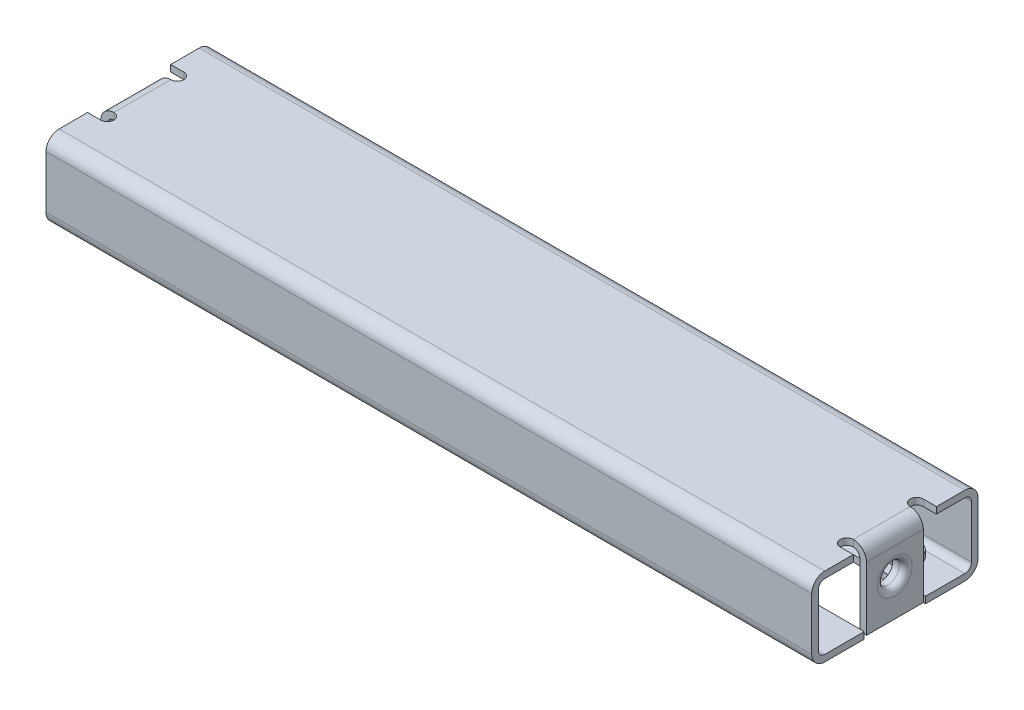
from build123d import *

# Parameters (mm, degrees)
BOSS_EXTRUDE1_DEPTH = 87.5
CUT_EXTRUDE1_REACH  = 93.33
BOSS_EXTRUDE2_DEPTH = 6.5
SKETCH4_W           = 3
SKETCH4_H           = 3.55
SKETCH5_W           = 175
SKETCH5_H           = 2.4585
FILLET1_R           = 1.5
SKETCH8_R           = 3.15
BOSS_EXTRUDE4_DEPTH = 1.5
SKETCH9_R           = 2.067
CUT_EXTRUDE3_DEPTH  = 91.786838253
FILLET3_R           = 1.5
FILLET4_R           = 3
FILLET5_R           = 1.5


with BuildPart() as part:
    # Sketch1 → Boss-Extrude1 (new, symmetric)
    with BuildSketch(Plane(origin=(0, 0, 0), x_dir=(0, 0, -1), z_dir=(1, 0, 0))):
        Polygon((-19, -9), (-7, -9), (-7, -7.5), (-17.5, -7.5), (-17.5, 7.5), (17.5, 7.5), (17.5, -7.5), (7, -7.5), (7, -9), (19, -9), (19, 9), (-19, 9), align=None)
    extrude(amount=BOSS_EXTRUDE1_DEPTH, both=True)

    # Sketch2 → Cut-Extrude1 (cut, up to next)
    with BuildSketch(Plane(origin=(0, 9, 0), x_dir=(1, 0, 0), z_dir=(0, 1, 0)), mode=Mode.PRIVATE) as cut_extrude1_sk1:
        with BuildLine():
            Line((84.5, 9.5), (87.5, 9.5))
            Line((87.5, 9.5), (87.5, -9.5))
            Line((87.5, -9.5), (84.5, -9.5))
            ThreePointArc((84.5, -9.5), (83, -8), (84.5, -6.5))
            Line((84.5, -6.5), (84.5, 6.5))
            ThreePointArc((84.5, 6.5), (83, 8), (84.5, 9.5))
        make_face()
    cut_extrude1_tool1 = extrude(cut_extrude1_sk1.sketch, amount=-CUT_EXTRUDE1_REACH, mode=Mode.PRIVATE) & part.part
    # Sketch2 → Cut-Extrude1 (cut, up to next)
    with BuildSketch(Plane(origin=(0, 9, 0), x_dir=(1, 0, 0), z_dir=(0, 1, 0)), mode=Mode.PRIVATE) as cut_extrude1_sk2:
        with BuildLine():
            Line((-84.5, 9.5), (-87.5, 9.5))
            Line((-87.5, 9.5), (-87.5, -9.5))
            Line((-87.5, -9.5), (-84.5, -9.5))
            ThreePointArc((-84.5, -9.5), (-83, -8), (-84.5, -6.5))
            Line((-84.5, -6.5), (-84.5, 6.5))
            ThreePointArc((-84.5, 6.5), (-83, 8), (-84.5, 9.5))
        make_face()
    cut_extrude1_tool2 = extrude(cut_extrude1_sk2.sketch, amount=-CUT_EXTRUDE1_REACH, mode=Mode.PRIVATE) & part.part
    add(cut_extrude1_tool1.solids().sort_by_distance((85.76427, 9, 0))[0], mode=Mode.SUBTRACT)
    add(cut_extrude1_tool2.solids().sort_by_distance((-85.76427, 9, 0))[0], mode=Mode.SUBTRACT)

    # Sketch3 → Boss-Extrude2 (add, symmetric)
    with BuildSketch(Plane.XY):
        with BuildLine():
            Line((87.5, -8.5), (87.5, 6))
            ThreePointArc((87.5, 6), (86.621320344, 8.121320344), (84.5, 9))
            Line((84.5, 9), (84.5, 7.5))
            ThreePointArc((84.5, 7.5), (85.560660172, 7.060660172), (86, 6))
            Line((86, 6), (86, -8.5))
            Line((86, -8.5), (87.5, -8.5))
        make_face()
        with BuildLine():
            Line((-87.5, -8.5), (-87.5, 6))
            ThreePointArc((-87.5, 6), (-86.621320344, 8.121320344), (-84.5, 9))
            Line((-84.5, 9), (-84.5, 7.5))
            ThreePointArc((-84.5, 7.5), (-85.560660172, 7.060660172), (-86, 6))
            Line((-86, 6), (-86, -8.5))
            Line((-86, -8.5), (-87.5, -8.5))
        make_face()
    extrude(amount=BOSS_EXTRUDE2_DEPTH, both=True)

    # Sketch4 → Revolve1 (revolve)
    with BuildSketch(Plane.XY, mode=Mode.PRIVATE) as revolve1_sk:
        with Locations((-86, 1.775)):
            Rectangle(SKETCH4_W, SKETCH4_H)
        with Locations((86, 1.775)):
            Rectangle(SKETCH4_W, SKETCH4_H)
    revolve(revolve1_sk.sketch.rotate(Axis((-87.5, 0, 0), (1, 0, 0)), 90), axis=Axis((-87.5, 0, 0), (1, 0, 0)))

    # Sketch5 → Cut-Revolve1 (revolve, cut)
    with BuildSketch(Plane.XY, mode=Mode.PRIVATE) as cut_revolve1_sk:
        with Locations((0, 1.22925)):
            Rectangle(SKETCH5_W, SKETCH5_H)
    revolve(cut_revolve1_sk.sketch.rotate(Axis((-87.5, 0, 0), (1, 0, 0)), 90), axis=Axis((-87.5, 0, 0), (1, 0, 0)), mode=Mode.SUBTRACT)

    # Fillet1
    fillet1_edges = [part.edges().sort_by_distance(p)[0] for p in [
        (87.5, 0, -2.4585),
        (-87.5, 0, -2.4585),
    ]]
    fillet(fillet1_edges, radius=FILLET1_R)

    # Sketch8 → Boss-Extrude4 (add)
    with BuildSketch(Plane(origin=(0, -7.5, 0), x_dir=(1, 0, 0), z_dir=(0, 1, 0))):
        with Locations(Location((-77.5, 12.5, 0), (0, 0, 90))):
            Circle(SKETCH8_R)
        with Locations(Location((-37.5, 12.5, 0), (0, 0, 90))):
            Circle(SKETCH8_R)
        with Locations(Location((-77.5, -12.5, 0), (0, 0, 90))):
            Circle(SKETCH8_R)
        with Locations(Location((-37.5, -12.5, 0), (0, 0, 90))):
            Circle(SKETCH8_R)
        with Locations(Location((37.5, 12.5, 0), (0, 0, 90))):
            Circle(SKETCH8_R)
        with Locations(Location((37.5, -12.5, 0), (0, 0, 90))):
            Circle(SKETCH8_R)
        with Locations(Location((77.5, -12.5, 0), (0, 0, 90))):
            Circle(SKETCH8_R)
        with Locations(Location((77.5, 12.5, 0), (0, 0, 90))):
            Circle(SKETCH8_R)
    extrude(amount=BOSS_EXTRUDE4_DEPTH)

    # Sketch9 → Cut-Extrude3 (cut, through all)
    with BuildSketch(Plane(origin=(0, -6, 0), x_dir=(1, 0, 0), z_dir=(0, 1, 0))):
        with Locations(Location((-77.5, 12.5, 0), (0, 0, 270))):
            Circle(SKETCH9_R)
        with Locations(Location((-77.5, -12.5, 0), (0, 0, 270))):
            Circle(SKETCH9_R)
        with Locations(Location((-37.5, 12.5, 0), (0, 0, 270))):
            Circle(SKETCH9_R)
        with Locations(Location((-37.5, -12.5, 0), (0, 0, 270))):
            Circle(SKETCH9_R)
        with Locations(Location((37.5, 12.5, 0), (0, 0, 270))):
            Circle(SKETCH9_R)
        with Locations(Location((37.5, -12.5, 0), (0, 0, 270))):
            Circle(SKETCH9_R)
        with Locations(Location((77.5, -12.5, 0), (0, 0, 270))):
            Circle(SKETCH9_R)
        with Locations(Location((77.5, 12.5, 0), (0, 0, 270))):
            Circle(SKETCH9_R)
    extrude(amount=-CUT_EXTRUDE3_DEPTH, mode=Mode.SUBTRACT)

    # Fillet3
    fillet3_edges = [part.edges().sort_by_distance(p)[0] for p in [
        (-77.5, -9, -14.567),
        (-77.5, -9, 10.433),
        (-37.5, -9, -14.567),
        (-37.5, -9, 10.433),
        (37.5, -9, -14.567),
        (37.5, -9, 10.433),
        (77.5, -9, 10.433),
        (77.5, -9, -14.567),
    ]]
    fillet(fillet3_edges, radius=FILLET3_R)

    # Fillet4
    # the kernel refuses this fillet: 3 mm, written as the material it takes off along each edge
    with BuildSketch(Plane(origin=(95, -9, 19), x_dir=(0, 1, 0), z_dir=(-1, 0, 0)), Plane(origin=(95, 9, 19), x_dir=(0, 0, -1), z_dir=(-1, 0, 0)), Plane(origin=(95, 9, -19), x_dir=(0, -1, 0), z_dir=(-1, 0, 0))) as fillet4_piece_1:
        with BuildLine():
            CenterArc((FILLET4_R, FILLET4_R), FILLET4_R, 180, 90)
            Line((0, FILLET4_R), (0, 0))
            Line((0, 0), (FILLET4_R, 0))
        make_face()
    extrude(amount=190, mode=Mode.SUBTRACT)
    with BuildSketch(Plane(origin=(-95, -9, -19), x_dir=(0, 0, 1), z_dir=(1, 0, 0))) as fillet4_piece_2:
        with BuildLine():
            CenterArc((FILLET4_R, -FILLET4_R), FILLET4_R, 90, 90)
            Line((0, -FILLET4_R), (0, 0))
            Line((0, 0), (FILLET4_R, 0))
        make_face()
    extrude(amount=190, mode=Mode.SUBTRACT)

    # Fillet5
    fillet5_edges = [part.edges().sort_by_distance(p)[0] for p in [
        (0, -7.5, -17.5),
        (0, 7.5, -17.5),
        (0, 7.5, 17.5),
        (0, -7.5, 17.5),
    ]]
    fillet(fillet5_edges, radius=FILLET5_R)


solid = part.part
